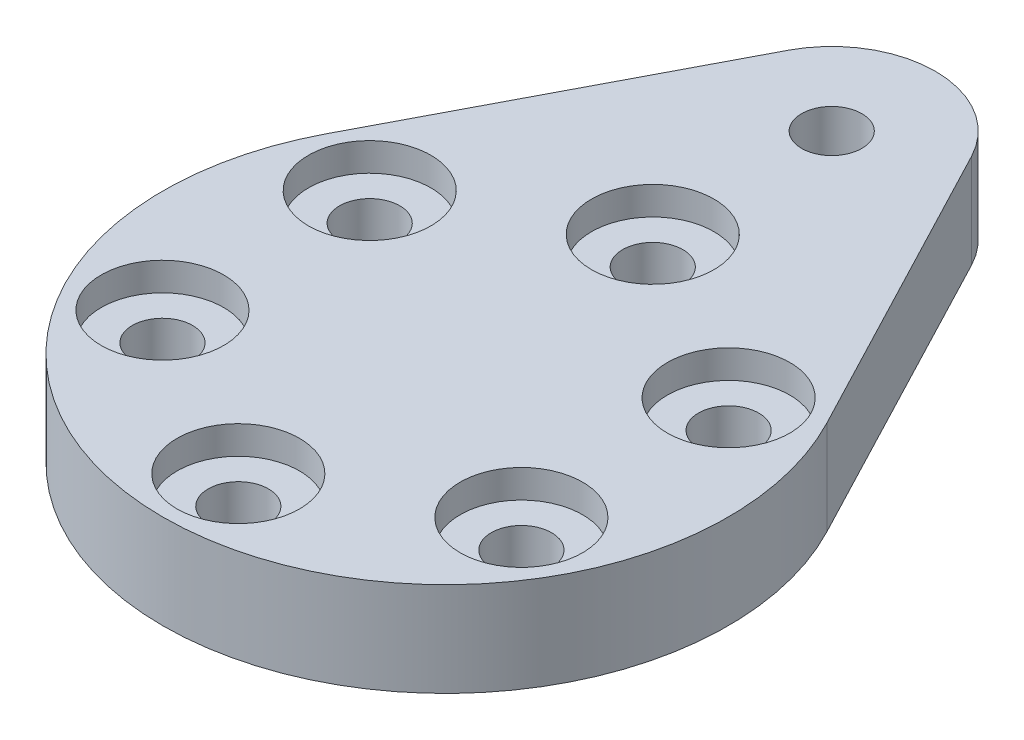
from build123d import *

# Parameters (mm, degrees)
SKETCH4_R           = 1.6
BOSS_EXTRUDE1_DEPTH = 5
SKETCH6_R           = 3.25
CUT_EXTRUDE1_DEPTH  = 1.5


with BuildPart() as part:
    # Sketch4 → Boss-Extrude1 (new body)
    with BuildSketch(Plane(origin=(0, 0, 0), x_dir=(1, 0, 0), z_dir=(0, 1, 0))):
        with BuildLine():
            Line((-4.873778619, 23.048780488), (-13.292123506, 6.951219512))
            ThreePointArc((-13.292123506, 6.951219512), (0, -15), (13.292123506, 6.951219512))
            Line((13.292123506, 6.951219512), (4.873778619, 23.048780488))
            ThreePointArc((4.873778619, 23.048780488), (0, 26), (-4.873778619, 23.048780488))
        make_face()
        with Locations((0, 20.5)):
            Circle(SKETCH4_R, mode=Mode.SUBTRACT)
        with Locations((9.526279442, 5.5)):
            Circle(SKETCH4_R, mode=Mode.SUBTRACT)
        with Locations((-9.526279442, -5.5)):
            Circle(SKETCH4_R, mode=Mode.SUBTRACT)
        with Locations((-9.526279442, 5.5)):
            Circle(SKETCH4_R, mode=Mode.SUBTRACT)
        with Locations((0, -11)):
            Circle(SKETCH4_R, mode=Mode.SUBTRACT)
        with Locations((9.526279442, -5.5)):
            Circle(SKETCH4_R, mode=Mode.SUBTRACT)
        with Locations((0, 11)):
            Circle(SKETCH4_R, mode=Mode.SUBTRACT)
    extrude(amount=BOSS_EXTRUDE1_DEPTH)

    # Sketch6 → Cut-Extrude1 (cut)
    with BuildSketch(Plane(origin=(0, 5, 0), x_dir=(1, 0, 0), z_dir=(0, 1, 0))):
        with Locations((0, 11)):
            Circle(SKETCH6_R)
        with Locations((9.526279442, 5.5)):
            Circle(SKETCH6_R)
        with Locations((9.526279442, -5.5)):
            Circle(SKETCH6_R)
        with Locations((0, -11)):
            Circle(SKETCH6_R)
        with Locations((-9.526279442, -5.5)):
            Circle(SKETCH6_R)
        with Locations((-9.526279442, 5.5)):
            Circle(SKETCH6_R)
    extrude(amount=-CUT_EXTRUDE1_DEPTH, mode=Mode.SUBTRACT)


solid = part.part
